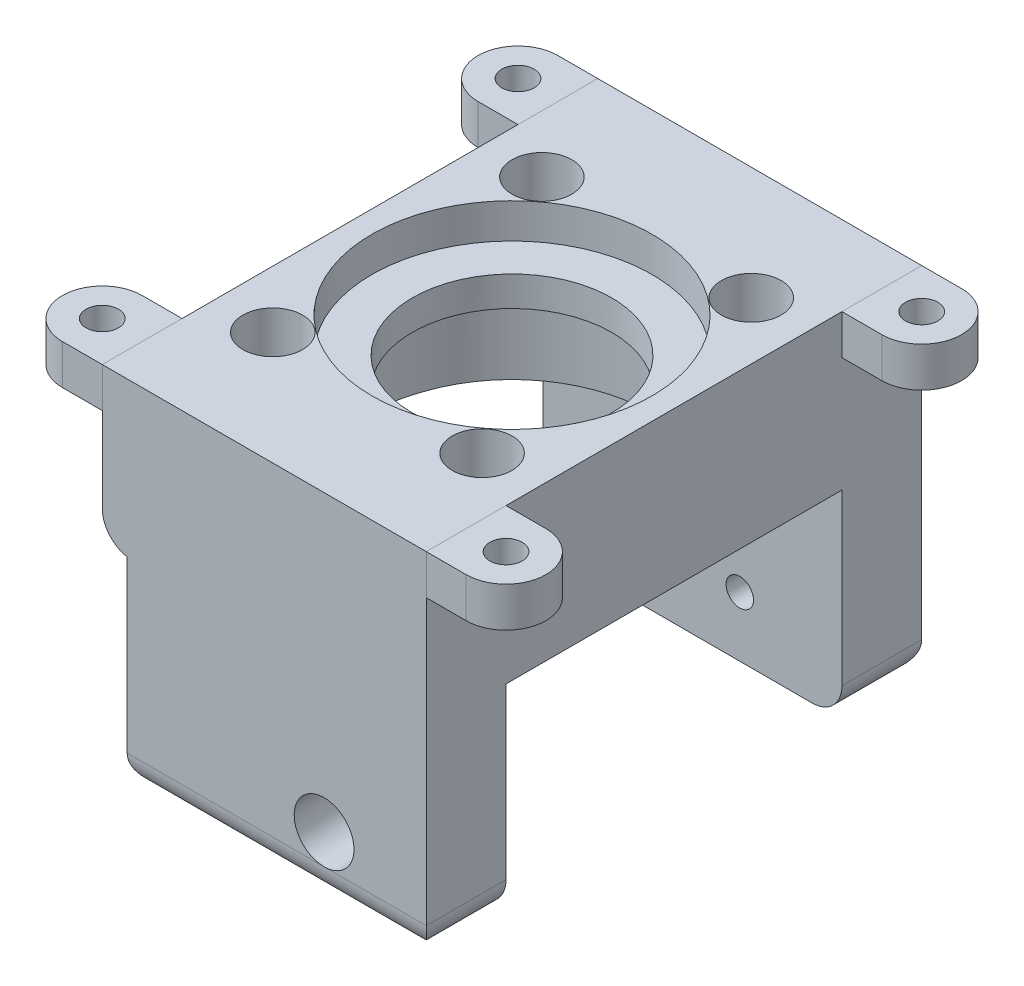
from build123d import *

# Parameters (mm, degrees)
SKETCH1_R             = 1.375
SKETCH1_R_2           = 1.460845326
SKETCH1_R_3           = 1.480655282
BOSS_EXTRUDE1_DEPTH   = 15
BOSS_EXTRUDE2_START   = -8
SKETCH2_R             = 14
SKETCH2_R_2           = 10
BOSS_EXTRUDE2_DEPTH   = 8
CUT_EXTRUDE1_START    = -3
SKETCH3_R             = 14
SKETCH3_R_2           = 10
CUT_EXTRUDE1_DEPTH    = 3
SKETCH5_R             = 1.480655282
SKETCH5_R_2           = 1.375
SKETCH5_R_3           = 1.460845326
BOSS_EXTRUDE3_DEPTH   = 0.5
BOSS_EXTRUDE4_DEPTH   = 5
SKETCH7_R             = 3
CUT_EXTRUDE2_DEPTH    = 12.5
SKETCH8_R             = 14.05
CUT_EXTRUDE3_DEPTH    = 3.5
SKETCH9_W             = 30
SKETCH9_H             = 8
BOSS_EXTRUDE6_DEPTH   = 20
BOSS_EXTRUDE6_2_DEPTH = 20
SKETCH10_W            = 30
SKETCH10_H            = 8
BOSS_EXTRUDE7_DEPTH   = 15.5
BOSS_EXTRUDE14_DEPTH  = 15.5
CUT_EXTRUDE11_START   = 15.5
SKETCH16_R            = 14.05
CUT_EXTRUDE11_DEPTH   = 15.5
SKETCH17_R            = 4
SKETCH17_R_2          = 1.625
BOSS_EXTRUDE15_DEPTH  = 4
SKETCH18_R            = 1.375
CUT_EXTRUDE12_DEPTH   = 55.5
SKETCH19_R            = 3
CUT_EXTRUDE13_DEPTH   = 5
CUT_EXTRUDE14_START   = -5
SKETCH20_R            = 3
CUT_EXTRUDE14_DEPTH   = 5
FILLET1_R             = 3
FILLET2_R             = 3
SKETCH21_R            = 14
CUT_EXTRUDE15_DEPTH   = 2


# Some blends are built 0.0001 mm under size
with BuildPart() as part:
    # Sketch1 → Boss-Extrude1 (new body)
    with BuildSketch(Plane(origin=(0, 0, 0), x_dir=(1, 0, 0), z_dir=(0, 1, 0))):
        with BuildLine():
            Line((-15, -16.85), (15, -16.85))
            Line((15, -16.85), (15, 16.85))
            Line((15, 16.85), (-15, 16.85))
            Line((-15, 16.85), (-15, 2.633913438))
            ThreePointArc((-15, 2.633913438), (0.072875656, 13.937359865), (12.75, 0))
            ThreePointArc((12.75, 0), (0.072875656, -13.937359865), (-15, -2.633913438))
            Line((-15, -2.633913438), (-15, -16.85))
        make_face()
        with Locations(Location((-11.75, -13.5, 0), (0, 0, 270))):
            Circle(SKETCH1_R, mode=Mode.SUBTRACT)
        with Locations(Location((9.25, -13.5, 0), (0, 0, 270))):
            Circle(SKETCH1_R_2, mode=Mode.SUBTRACT)
        with Locations(Location((-11.75, 13.5, 0), (0, 0, 270))):
            Circle(SKETCH1_R, mode=Mode.SUBTRACT)
        with Locations(Location((9.25, 13.5, 0), (0, 0, 270))):
            Circle(SKETCH1_R_3, mode=Mode.SUBTRACT)
    extrude(amount=BOSS_EXTRUDE1_DEPTH)

    # Sketch2 → Boss-Extrude2 (add)
    with BuildSketch(Plane(origin=(0, 15, 0), x_dir=(1, 0, 0), z_dir=(0, 1, 0)).offset(BOSS_EXTRUDE2_START)):
        with Locations((-1.25, 0)):
            Circle(SKETCH2_R)
        with Locations(Location((-1.25, 0, 0), (0, 0, 270))):
            Circle(SKETCH2_R_2, mode=Mode.SUBTRACT)
    extrude(amount=BOSS_EXTRUDE2_DEPTH)

    # Sketch3 → Cut-Extrude1 (cut)
    with BuildSketch(Plane(origin=(0, 15, 0), x_dir=(1, 0, 0), z_dir=(0, 1, 0)).offset(CUT_EXTRUDE1_START)):
        with Locations((-1.25, 0)):
            Circle(SKETCH3_R)
        with Locations(Location((-1.25, 0, 0), (0, 0, 270))):
            Circle(SKETCH3_R_2, mode=Mode.SUBTRACT)
    extrude(amount=CUT_EXTRUDE1_DEPTH, mode=Mode.SUBTRACT)

    # Sketch5 → Boss-Extrude3 (add)
    with BuildSketch(Plane(origin=(0, 15, 0), x_dir=(1, 0, 0), z_dir=(0, 1, 0))):
        with BuildLine():
            Line((-15, 16.85), (-15, 2.633913438))
            ThreePointArc((-15, 2.633913438), (12.75, 0), (-15, -2.633913438))
            Line((-15, -2.633913438), (-15, -16.85))
            Line((-15, -16.85), (15, -16.85))
            Line((15, -16.85), (15, 16.85))
            Line((15, 16.85), (-15, 16.85))
        make_face()
        with Locations(Location((9.25, 13.5, 0), (0, 0, 270))):
            Circle(SKETCH5_R, mode=Mode.SUBTRACT)
        with Locations(Location((-11.75, -13.5, 0), (0, 0, 270))):
            Circle(SKETCH5_R_2, mode=Mode.SUBTRACT)
        with Locations(Location((-11.75, 13.5, 0), (0, 0, 270))):
            Circle(SKETCH5_R_2, mode=Mode.SUBTRACT)
        with Locations(Location((9.25, -13.5, 0), (0, 0, 270))):
            Circle(SKETCH5_R_3, mode=Mode.SUBTRACT)
    extrude(amount=BOSS_EXTRUDE3_DEPTH)

    # Sketch6 → Boss-Extrude4 (add)
    with BuildSketch(Plane(origin=(0, 15.5, 0), x_dir=(1, 0, 0), z_dir=(0, 1, 0))):
        with BuildLine():
            ThreePointArc((-1.625, 20.35), (0, 21.975), (1.625, 20.35))
            Line((1.625, 20.35), (3.5, 20.35))
            ThreePointArc((3.5, 20.35), (0, 23.85), (-3.5, 20.35))
            Line((-3.5, 20.35), (-1.625, 20.35))
        make_face()
        with BuildLine():
            Line((3.5, 20.35), (1.625, 20.35))
            ThreePointArc((1.625, 20.35), (0, 18.725), (-1.625, 20.35))
            Line((-1.625, 20.35), (-3.5, 20.35))
            ThreePointArc((-3.5, 20.35), (-2.474873743, 17.875126275), (-2.6e-08, 16.85))
            ThreePointArc((-2.6e-08, 16.85), (2.474873725, 17.875126257), (3.5, 20.35))
        make_face()
        with BuildLine():
            Line((3.5, 16.85), (3.5, 20.35))
            ThreePointArc((3.5, 20.35), (2.474873725, 17.875126257), (-2.6e-08, 16.85))
            Line((-2.6e-08, 16.85), (3.5, 16.85))
        make_face()
        with BuildLine():
            ThreePointArc((-2.6e-08, 16.85), (-2.474873743, 17.875126275), (-3.5, 20.35))
            Line((-3.5, 20.35), (-3.5, 16.85))
            Line((-3.5, 16.85), (-2.6e-08, 16.85))
        make_face()
        with BuildLine():
            ThreePointArc((-3.5, -20.35), (-2.474873734, -17.875126266), (0, -16.85))
            Line((0, -16.85), (-3.5, -16.85))
            Line((-3.5, -16.85), (-3.5, -20.35))
        make_face()
        with BuildLine():
            Line((3.5, -20.35), (3.5, -16.85))
            Line((3.5, -16.85), (0, -16.85))
            ThreePointArc((0, -16.85), (2.474873734, -17.875126266), (3.5, -20.35))
        make_face()
        with BuildLine():
            ThreePointArc((-3.5, -20.35), (0, -23.85), (3.5, -20.35))
            Line((3.5, -20.35), (1.625, -20.35))
            ThreePointArc((1.625, -20.35), (0, -21.975), (-1.625, -20.35))
            Line((-1.625, -20.35), (-3.5, -20.35))
        make_face()
        with BuildLine():
            Line((1.625, -20.35), (3.5, -20.35))
            ThreePointArc((3.5, -20.35), (2.474873734, -17.875126266), (0, -16.85))
            ThreePointArc((0, -16.85), (-2.474873734, -17.875126266), (-3.5, -20.35))
            Line((-3.5, -20.35), (-1.625, -20.35))
            ThreePointArc((-1.625, -20.35), (0, -18.725), (1.625, -20.35))
        make_face()
    extrude(amount=-BOSS_EXTRUDE4_DEPTH)

    # Sketch7 → Cut-Extrude2 (cut)
    with BuildSketch(Plane(origin=(0, 15.5, 0), x_dir=(1, 0, 0), z_dir=(0, 1, 0))):
        with Locations(Location((-11.75, 13.5, 0), (0, 0, 270))):
            Circle(SKETCH7_R)
        with Locations(Location((9.25, 13.5, 0), (0, 0, 270))):
            Circle(SKETCH7_R)
        with Locations(Location((9.25, -13.5, 0), (0, 0, 270))):
            Circle(SKETCH7_R)
        with Locations(Location((-11.75, -13.5, 0), (0, 0, 270))):
            Circle(SKETCH7_R)
    extrude(amount=-CUT_EXTRUDE2_DEPTH, mode=Mode.SUBTRACT)

    # Sketch8 → Cut-Extrude3 (cut)
    with BuildSketch(Plane(origin=(0, 15.5, 0), x_dir=(1, 0, 0), z_dir=(0, 1, 0))):
        with Locations((-1.25, 0)):
            Circle(SKETCH8_R)
    extrude(amount=-CUT_EXTRUDE3_DEPTH, mode=Mode.SUBTRACT)



with BuildPart() as body_2:
    # Sketch9 → Boss-Extrude6 (new body)
    with BuildSketch(Plane.XZ):
        with Locations((0, 20.85)):
            Rectangle(SKETCH9_W, SKETCH9_H)
    extrude(amount=BOSS_EXTRUDE6_DEPTH)


with BuildPart() as body_3:
    # Sketch9 → Boss-Extrude6 2 (new body)
    with BuildSketch(Plane.XZ):
        with Locations((0, -20.85)):
            Rectangle(SKETCH9_W, SKETCH9_H)
    extrude(amount=BOSS_EXTRUDE6_2_DEPTH)


with BuildPart() as part_1:
    add(part.part)

    add(body_2.part)  # Boss-Extrude7 merges body 2

    add(body_3.part)  # Boss-Extrude7 merges body 3
    # Sketch10 → Boss-Extrude7 (add)
    with BuildSketch(Plane(origin=(0, 0, 0), x_dir=(1, 0, 0), z_dir=(0, 1, 0))):
        with Locations((0, 20.85)):
            Rectangle(SKETCH10_W, SKETCH10_H)
        with Locations((0, -20.85)):
            Rectangle(SKETCH10_W, SKETCH10_H)
    extrude(amount=BOSS_EXTRUDE7_DEPTH)

    # Sketch15 → Boss-Extrude14 (add)
    with BuildSketch(Plane.XZ):
        with BuildLine():
            Line((-15, 24.85), (-17.5, 24.85))
            Line((-17.5, 24.85), (-17.5, -24.85))
            Line((-17.5, -24.85), (-15, -24.85))
            Line((-15, -24.85), (-15, -16.85))
            Line((-15, -16.85), (-15, -2.633913438))
            ThreePointArc((-15, -2.633913438), (-15.25, 0), (-15, 2.633913438))
            Line((-15, 2.633913438), (-15, 16.85))
            Line((-15, 16.85), (-15, 24.85))
        make_face()
    extrude(amount=-BOSS_EXTRUDE14_DEPTH)

    # Sketch16 → Cut-Extrude11 (cut)
    with BuildSketch(Plane(origin=(0, 12, 0), x_dir=(1, 0, 0), z_dir=(0, 1, 0)).offset(CUT_EXTRUDE11_START)):
        with Locations(Location((-1.25, 0, 0), (0, 0, 270))):
            Circle(SKETCH16_R)
    extrude(amount=-CUT_EXTRUDE11_DEPTH, mode=Mode.SUBTRACT)

    # Sketch18 → Cut-Extrude12 (cut)
    with BuildSketch(Plane(origin=(0, 0, -24.85), x_dir=(-1, 0, 0), z_dir=(0, 0, -1))):
        with Locations((-4.75, -14)):
            Circle(SKETCH18_R)
    extrude(amount=-CUT_EXTRUDE12_DEPTH, mode=Mode.SUBTRACT)

    # Sketch19 → Cut-Extrude13 (cut)
    with BuildSketch(Plane.XY.offset(24.85)):
        with Locations((4.75, -14)):
            Circle(SKETCH19_R)
    extrude(amount=-CUT_EXTRUDE13_DEPTH, mode=Mode.SUBTRACT)

    # Sketch20 → Cut-Extrude14 (cut)
    with BuildSketch(Plane(origin=(0, 0, -24.85), x_dir=(-1, 0, 0), z_dir=(0, 0, -1)).offset(CUT_EXTRUDE14_START)):
        with Locations(Location((-4.75, -14, 0), (0, 0, 180))):
            Circle(SKETCH20_R)
    extrude(amount=CUT_EXTRUDE14_DEPTH, mode=Mode.SUBTRACT)

    # Fillet1
    # the kernel refuses this fillet: 3 mm, written as the material it takes off along each edge
    with BuildSketch(Plane(origin=(-17.5, 0, 32.35), x_dir=(1, 0, 0), z_dir=(0, 0, -1))) as fillet1_piece_1_section:
        with BuildLine():
            CenterArc((FILLET1_R, -FILLET1_R), FILLET1_R, 90, 90)
            Line((0, -FILLET1_R), (0, 0))
            Line((0, 0), (FILLET1_R, 0))
        make_face()
    fillet1_piece_1 = extrude(amount=64.7, mode=Mode.PRIVATE)
    fillet1_piece_1 = split(fillet1_piece_1, bisect_by=Plane(origin=(-15, 0.690666213, 24.6), z_dir=(-1, 0, 0)), keep=Keep.TOP, mode=Mode.PRIVATE)
    fillet1_piece_1 = split(fillet1_piece_1, bisect_by=Plane(origin=(-16.854336026, 0.690666213, 16.85), z_dir=(0, 0, 1)), keep=Keep.TOP, mode=Mode.PRIVATE)
    add(fillet1_piece_1, mode=Mode.SUBTRACT)
    with BuildSketch(Plane(origin=(-17.5, 0, 32.35), x_dir=(1, 0, 0), z_dir=(0, 0, -1))) as fillet1_piece_2_section:
        with BuildLine():
            CenterArc((FILLET1_R, -FILLET1_R), FILLET1_R, 90, 90)
            Line((0, -FILLET1_R), (0, 0))
            Line((0, 0), (FILLET1_R, 0))
        make_face()
    fillet1_piece_2 = extrude(amount=64.7, mode=Mode.PRIVATE)
    fillet1_piece_2 = split(fillet1_piece_2, bisect_by=Plane(origin=(-15, -0.021970268, 0), z_dir=(1, 0, 0)), keep=Keep.TOP, mode=Mode.PRIVATE)
    fillet1_piece_2 = split(fillet1_piece_2, bisect_by=Plane(origin=(-14.773609576, -0.021970268, 16.85), z_dir=(0, 0, -1)), keep=Keep.TOP, mode=Mode.PRIVATE)
    fillet1_piece_2 = split(fillet1_piece_2, bisect_by=Plane(origin=(-14.773609576, -0.021970268, -16.85), z_dir=(0, 0, 1)), keep=Keep.TOP, mode=Mode.PRIVATE)
    add(fillet1_piece_2, mode=Mode.SUBTRACT)
    with BuildSketch(Plane(origin=(-17.5, 0, 32.35), x_dir=(1, 0, 0), z_dir=(0, 0, -1))) as fillet1_piece_3_section:
        with BuildLine():
            CenterArc((FILLET1_R, -FILLET1_R), FILLET1_R, 90, 90)
            Line((0, -FILLET1_R), (0, 0))
            Line((0, 0), (FILLET1_R, 0))
        make_face()
    fillet1_piece_3 = extrude(amount=64.7, mode=Mode.PRIVATE)
    fillet1_piece_3 = split(fillet1_piece_3, bisect_by=Plane(origin=(-15, 0.690666213, 0), z_dir=(-1, 0, 0)), keep=Keep.TOP, mode=Mode.PRIVATE)
    fillet1_piece_3 = split(fillet1_piece_3, bisect_by=Plane(origin=(-16.854336026, 0.690666213, 16.85), z_dir=(0, 0, -1)), keep=Keep.TOP, mode=Mode.PRIVATE)
    fillet1_piece_3 = split(fillet1_piece_3, bisect_by=Plane(origin=(-16.854336026, 0.690666213, -16.85), z_dir=(0, 0, 1)), keep=Keep.TOP, mode=Mode.PRIVATE)
    add(fillet1_piece_3, mode=Mode.SUBTRACT)
    with BuildSketch(Plane(origin=(-17.5, 0, 32.35), x_dir=(1, 0, 0), z_dir=(0, 0, -1))) as fillet1_piece_4_section:
        with BuildLine():
            CenterArc((FILLET1_R, -FILLET1_R), FILLET1_R, 90, 90)
            Line((0, -FILLET1_R), (0, 0))
            Line((0, 0), (FILLET1_R, 0))
        make_face()
    fillet1_piece_4 = extrude(amount=64.7, mode=Mode.PRIVATE)
    fillet1_piece_4 = split(fillet1_piece_4, bisect_by=Plane(origin=(-15, 0.690666213, -24.6), z_dir=(-1, 0, 0)), keep=Keep.TOP, mode=Mode.PRIVATE)
    fillet1_piece_4 = split(fillet1_piece_4, bisect_by=Plane(origin=(-16.854336026, 0.690666213, -16.85), z_dir=(0, 0, -1)), keep=Keep.TOP, mode=Mode.PRIVATE)
    add(fillet1_piece_4, mode=Mode.SUBTRACT)

    # Fillet2
    fillet2_edges = [part_1.edges().sort_by_distance(p)[0] for p in [
        (15, -20, -20.85),
        (-15, -20, -20.85),
        (0, -20, -24.85),
        (15, -20, 20.85),
        (0, -20, 24.85),
        (-15, -20, 20.85),
    ]]
    fillet(fillet2_edges, radius=FILLET2_R - 0.0001)  # a hair under: the kernel refuses the full size

    # Sketch21 → Cut-Extrude15 (cut)
    with BuildSketch(Plane.XZ.offset(-7)):
        with Locations(Location((-1.25, 0, 0), (0, 0, 270))):
            Circle(SKETCH21_R)
    extrude(amount=-CUT_EXTRUDE15_DEPTH, mode=Mode.SUBTRACT)


with BuildPart() as body_2_2:
    # Sketch17 → Boss-Extrude15 (new body)
    # profile 1 of 12: a face of its own
    with BuildSketch(Plane(origin=(0, 15.5, 0), x_dir=(1, 0, 0), z_dir=(0, 1, 0))):
        with Locations((-21.5, 20.85)):
            Circle(SKETCH17_R)
        with Locations(Location((-21.5, 20.85, 0), (0, 0, 270))):
            Circle(SKETCH17_R_2, mode=Mode.SUBTRACT)
    # profile 2 of 12: a face of its own
    with BuildSketch(Plane(origin=(0, 15.5, 0), x_dir=(1, 0, 0), z_dir=(0, 1, 0))):
        with BuildLine():
            Line((-17.5, -20.85), (-17.5, -16.85))
            Line((-17.5, -16.85), (-21.5, -16.85))
            ThreePointArc((-21.5, -16.85), (-18.671572875, -18.021572875), (-17.5, -20.85))
        make_face()
    # profile 3 of 12: a face of its own
    with BuildSketch(Plane(origin=(0, 15.5, 0), x_dir=(1, 0, 0), z_dir=(0, 1, 0))):
        with BuildLine():
            Line((-17.5, -24.85), (-17.5, -20.85))
            ThreePointArc((-17.5, -20.85), (-18.671572875, -23.678427125), (-21.5, -24.85))
            Line((-21.5, -24.85), (-17.5, -24.85))
        make_face()
    # profile 4 of 12: a face of its own
    with BuildSketch(Plane(origin=(0, 15.5, 0), x_dir=(1, 0, 0), z_dir=(0, 1, 0))):
        with Locations((-21.5, -20.85)):
            Circle(SKETCH17_R)
        with Locations(Location((-21.5, -20.85, 0), (0, 0, 270))):
            Circle(SKETCH17_R_2, mode=Mode.SUBTRACT)
    # profile 5 of 12: a face of its own
    with BuildSketch(Plane(origin=(0, 15.5, 0), x_dir=(1, 0, 0), z_dir=(0, 1, 0))):
        with BuildLine():
            Line((19, -16.85), (15, -16.85))
            Line((15, -16.85), (15, -20.85))
            ThreePointArc((15, -20.85), (16.171572875, -18.021572875), (19, -16.85))
        make_face()
    # profile 6 of 12: a face of its own
    with BuildSketch(Plane(origin=(0, 15.5, 0), x_dir=(1, 0, 0), z_dir=(0, 1, 0))):
        with Locations((19, -20.85)):
            Circle(SKETCH17_R)
        with Locations(Location((19, -20.85, 0), (0, 0, 270))):
            Circle(SKETCH17_R_2, mode=Mode.SUBTRACT)
    # profile 7 of 12: a face of its own
    with BuildSketch(Plane(origin=(0, 15.5, 0), x_dir=(1, 0, 0), z_dir=(0, 1, 0))):
        with BuildLine():
            ThreePointArc((19, -24.85), (16.171572875, -23.678427125), (15, -20.85))
            Line((15, -20.85), (15, -24.85))
            Line((15, -24.85), (19, -24.85))
        make_face()
    # profile 8 of 12: a face of its own
    with BuildSketch(Plane(origin=(0, 15.5, 0), x_dir=(1, 0, 0), z_dir=(0, 1, 0))):
        with Locations((19, 20.85)):
            Circle(SKETCH17_R)
        with Locations(Location((19, 20.85, 0), (0, 0, 270))):
            Circle(SKETCH17_R_2, mode=Mode.SUBTRACT)
    # profile 9 of 12: a face of its own
    with BuildSketch(Plane(origin=(0, 15.5, 0), x_dir=(1, 0, 0), z_dir=(0, 1, 0))):
        with BuildLine():
            Line((19, 24.85), (15, 24.85))
            Line((15, 24.85), (15, 20.85))
            ThreePointArc((15, 20.85), (16.171572875, 23.678427125), (19, 24.85))
        make_face()
    # profile 10 of 12: a face of its own
    with BuildSketch(Plane(origin=(0, 15.5, 0), x_dir=(1, 0, 0), z_dir=(0, 1, 0))):
        with BuildLine():
            ThreePointArc((19, 16.85), (16.171572875, 18.021572875), (15, 20.85))
            Line((15, 20.85), (15, 16.85))
            Line((15, 16.85), (19, 16.85))
        make_face()
    # profile 11 of 12: a face of its own
    with BuildSketch(Plane(origin=(0, 15.5, 0), x_dir=(1, 0, 0), z_dir=(0, 1, 0))):
        with BuildLine():
            Line((-17.5, 16.85), (-17.5, 20.85))
            ThreePointArc((-17.5, 20.85), (-18.671572875, 18.021572875), (-21.5, 16.85))
            Line((-21.5, 16.85), (-17.5, 16.85))
        make_face()
    # profile 12 of 12: a face of its own
    with BuildSketch(Plane(origin=(0, 15.5, 0), x_dir=(1, 0, 0), z_dir=(0, 1, 0))):
        with BuildLine():
            Line((-17.5, 24.85), (-21.5, 24.85))
            ThreePointArc((-21.5, 24.85), (-18.671572875, 23.678427125), (-17.5, 20.85))
            Line((-17.5, 20.85), (-17.5, 24.85))
        make_face()
    extrude(amount=-BOSS_EXTRUDE15_DEPTH)


solid = Compound([part_1.part, body_2_2.part])
